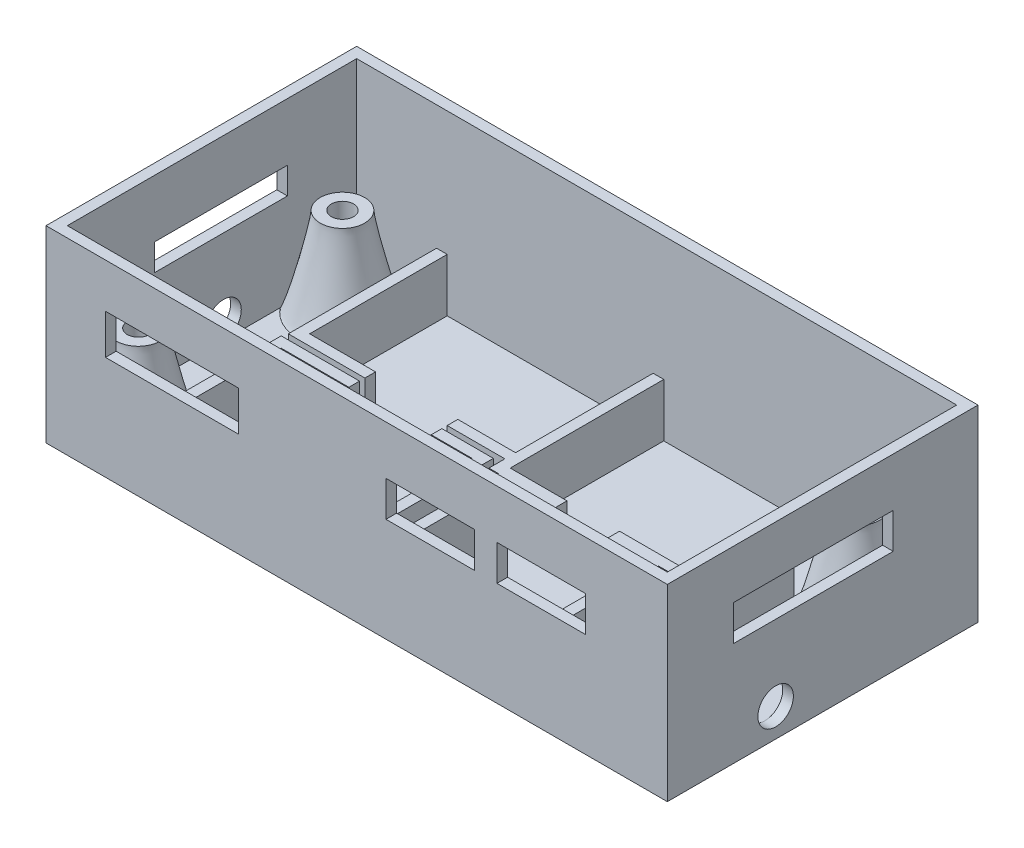
from build123d import *

# Parameters (mm, degrees)
SKETCH1_W           = 70
SKETCH1_H           = 35
BOSS_EXTRUDE1_DEPTH = 1.2
SKETCH2_W           = 70
SKETCH2_H           = 35
SKETCH2_W_2         = 67.6
SKETCH2_H_2         = 32.6
BOSS_EXTRUDE2_DEPTH = 20
SKETCH3_R           = 2.5
BOSS_EXTRUDE3_DEPTH = 10
SKETCH4_R           = 1.25
CUT_EXTRUDE1_DEPTH  = 80.05972426
SKETCH5_W           = 15
SKETCH5_H           = 3
CUT_EXTRUDE2_DEPTH  = 2
SKETCH7_W           = 10
SKETCH7_H           = 4
CUT_EXTRUDE3_DEPTH  = 2
SKETCH8_W           = 15
SKETCH8_H           = 4.5
CUT_EXTRUDE4_DEPTH  = 2
SKETCH9_W           = 18
SKETCH9_H           = 4
CUT_EXTRUDE5_DEPTH  = 2
FILLET1_SIZE        = 2.5
FILLET1_SIZE_2      = 10
BOSS_EXTRUDE4_DEPTH = 6
SKETCH11_W          = 1.2
SKETCH11_H          = 2.446219204
BOSS_EXTRUDE5_DEPTH = 6
BOSS_EXTRUDE6_DEPTH = 6
BOSS_EXTRUDE7_DEPTH = 6
SKETCH14_W          = 9.2726773
SKETCH14_H          = 6.430225757
SKETCH14_W_2        = 5.919458203
SKETCH14_H_2        = 4.800445035
CUT_EXTRUDE6_DEPTH  = 5
SKETCH15_R          = 2
CUT_EXTRUDE7_DEPTH  = 2
SKETCH16_R          = 2
CUT_EXTRUDE8_DEPTH  = 2


with BuildPart() as part:
    # Sketch1 → Boss-Extrude1 (new body)
    with BuildSketch(Plane(origin=(0, 0, 0), x_dir=(1, 0, 0), z_dir=(0, 1, 0))):
        with Locations((35, -17.5)):
            Rectangle(SKETCH1_W, SKETCH1_H)
    extrude(amount=BOSS_EXTRUDE1_DEPTH)

    # Sketch2 → Boss-Extrude2 (add)
    with BuildSketch(Plane(origin=(0, 1.2, 0), x_dir=(1, 0, 0), z_dir=(0, 1, 0))):
        with Locations((35, -17.5)):
            Rectangle(SKETCH2_W, SKETCH2_H)
        with Locations((35, -17.5)):
            Rectangle(SKETCH2_W_2, SKETCH2_H_2, mode=Mode.SUBTRACT)
    extrude(amount=BOSS_EXTRUDE2_DEPTH)

    # Sketch3 → Boss-Extrude3 (add)
    with BuildSketch(Plane(origin=(0, 1.2, 0), x_dir=(1, 0, 0), z_dir=(0, 1, 0))):
        with Locations(Location((5.2, -29.8, 0), (0, 0, 270))):
            Circle(SKETCH3_R)
        with Locations(Location((63.2, -29.8, 0), (0, 0, 270))):
            Circle(SKETCH3_R)
        with Locations(Location((63.2, -6.8, 0), (0, 0, 270))):
            Circle(SKETCH3_R)
        with Locations(Location((5.2, -6.8, 0), (0, 0, 270))):
            Circle(SKETCH3_R)
    extrude(amount=BOSS_EXTRUDE3_DEPTH)

    # Sketch4 → Cut-Extrude1 (cut, through all)
    with BuildSketch(Plane(origin=(0, 11.2, 0), x_dir=(1, 0, 0), z_dir=(0, 1, 0))):
        with Locations(Location((5.2, -29.8, 0), (0, 0, 270))):
            Circle(SKETCH4_R)
        with Locations(Location((5.2, -6.8, 0), (0, 0, 270))):
            Circle(SKETCH4_R)
        with Locations(Location((63.2, -6.8, 0), (0, 0, 270))):
            Circle(SKETCH4_R)
        with Locations(Location((63.2, -29.8, 0), (0, 0, 270))):
            Circle(SKETCH4_R)
    extrude(amount=-CUT_EXTRUDE1_DEPTH, mode=Mode.SUBTRACT)

    # Sketch5 → Cut-Extrude2 (cut)
    with BuildSketch(Plane.ZY):
        with Locations((16.5, 13.2)):
            Rectangle(SKETCH5_W, SKETCH5_H)
    extrude(amount=-CUT_EXTRUDE2_DEPTH, mode=Mode.SUBTRACT)

    # Sketch7 → Cut-Extrude3 (cut)
    with BuildSketch(Plane(origin=(0, 0, 33.8), x_dir=(-1, 0, 0), z_dir=(0, 0, -1))):
        with Locations((-55.8, 13.7)):
            Rectangle(SKETCH7_W, SKETCH7_H)
        with Locations((-43.3, 13.7)):
            Rectangle(SKETCH7_W, SKETCH7_H)
    extrude(amount=-CUT_EXTRUDE3_DEPTH, mode=Mode.SUBTRACT)

    # Sketch8 → Cut-Extrude4 (cut)
    with BuildSketch(Plane(origin=(0, 0, 33.8), x_dir=(-1, 0, 0), z_dir=(0, 0, -1))):
        with Locations((-14.2, 13.95)):
            Rectangle(SKETCH8_W, SKETCH8_H)
    extrude(amount=-CUT_EXTRUDE4_DEPTH, mode=Mode.SUBTRACT)

    # Sketch9 → Cut-Extrude5 (cut)
    with BuildSketch(Plane.ZY.offset(-68.8)):
        with Locations((18.55, 13.7)):
            Rectangle(SKETCH9_W, SKETCH9_H)
    extrude(amount=-CUT_EXTRUDE5_DEPTH, mode=Mode.SUBTRACT)

    # Fillet1
    # a fillet whose section is not a circle: 10, 2.5 mm, written as the material it adds along each edge
    with BuildSketch(Plane(origin=(5.2, 1.2, 29.8), x_dir=(0, 0, 1), z_dir=(-1, 0, 0))) as fillet1_piece_1:
        with BuildLine():
            Bezier((2.5 + FILLET1_SIZE, 0), (2.5, 0), (2.5, FILLET1_SIZE_2), weights=[1, 0.111111111, 1])
            Line((2.5, FILLET1_SIZE_2), (2.5, 0))
            Line((2.5, 0), (2.5 + FILLET1_SIZE, 0))
        make_face()
    revolve(axis=Axis((5.2, 1.2, 29.8), (0, 1, 0)))
    with BuildSketch(Plane(origin=(63.2, 1.2, 29.8), x_dir=(0, 0, 1), z_dir=(-1, 0, 0))) as fillet1_piece_2:
        with BuildLine():
            Bezier((2.5 + FILLET1_SIZE, 0), (2.5, 0), (2.5, FILLET1_SIZE_2), weights=[1, 0.111111111, 1])
            Line((2.5, FILLET1_SIZE_2), (2.5, 0))
            Line((2.5, 0), (2.5 + FILLET1_SIZE, 0))
        make_face()
    revolve(axis=Axis((63.2, 1.2, 29.8), (0, 1, 0)))
    with BuildSketch(Plane(origin=(63.2, 1.2, 6.8), x_dir=(0, 0, 1), z_dir=(-1, 0, 0))) as fillet1_piece_3:
        with BuildLine():
            Bezier((2.5 + FILLET1_SIZE, 0), (2.5, 0), (2.5, FILLET1_SIZE_2), weights=[1, 0.111111111, 1])
            Line((2.5, FILLET1_SIZE_2), (2.5, 0))
            Line((2.5, 0), (2.5 + FILLET1_SIZE, 0))
        make_face()
    revolve(axis=Axis((63.2, 1.2, 6.8), (0, 1, 0)))
    with BuildSketch(Plane(origin=(5.2, 1.2, 6.8), x_dir=(0, 0, 1), z_dir=(-1, 0, 0))) as fillet1_piece_4:
        with BuildLine():
            Bezier((2.5 + FILLET1_SIZE, 0), (2.5, 0), (2.5, FILLET1_SIZE_2), weights=[1, 0.111111111, 1])
            Line((2.5, FILLET1_SIZE_2), (2.5, 0))
            Line((2.5, 0), (2.5 + FILLET1_SIZE, 0))
        make_face()
    revolve(axis=Axis((5.2, 1.2, 6.8), (0, 1, 0)))

    # Sketch10 → Boss-Extrude4 (add)
    with BuildSketch(Plane(origin=(0, 1.2, 0), x_dir=(1, 0, 0), z_dir=(0, 1, 0))):
        Polygon((11.4, -16.7), (11.4, -1.2), (10.2, -1.2), (10.2, -17.9), (35.8, -17.9), (35.8, -1.2), (34.6, -1.2), (34.6, -16.7), align=None)
    extrude(amount=BOSS_EXTRUDE4_DEPTH)

    # Sketch11 → Boss-Extrude5 (add)
    with BuildSketch(Plane(origin=(0, 1.2, 0), x_dir=(1, 0, 0), z_dir=(0, 1, 0))):
        with Locations((58.5, -2.423109602)):
            Rectangle(SKETCH11_W, SKETCH11_H)
        Polygon((35.8, -17.9), (35.8, -18.5), (57.9, -18.5), (57.9, -9.85), (59.1, -9.85), (59.1, -19.7), (35.8, -19.7), (34.6, -19.7), (34.6, -17.9), align=None)
    extrude(amount=BOSS_EXTRUDE5_DEPTH)

    # Sketch12 → Boss-Extrude6 (add)
    with BuildSketch(Plane(origin=(0, 1.2, 0), x_dir=(1, 0, 0), z_dir=(0, 1, 0))):
        Polygon((11.2, -33.8), (11.2, -19.7), (32.7, -19.7), (32.7, -33.8), (33.9, -33.8), (33.9, -18.5), (10, -18.5), (10, -33.8), align=None)
    extrude(amount=BOSS_EXTRUDE6_DEPTH)

    # Sketch13 → Boss-Extrude7 (add)
    with BuildSketch(Plane(origin=(0, 1.2, 0), x_dir=(1, 0, 0), z_dir=(0, 1, 0))):
        Polygon((36.9, -33.8), (36.9, -20), (52.5, -20), (52.5, -33.8), (53.7, -33.8), (53.7, -19.7), (35.7, -19.7), (35.7, -33.8), align=None)
    extrude(amount=BOSS_EXTRUDE7_DEPTH)

    # Sketch14 → Cut-Extrude6 (cut)
    with BuildSketch(Plane(origin=(0, 7.2, 0), x_dir=(1, 0, 0), z_dir=(0, 1, 0))):
        with Locations((23.462805907, -18.345143962)):
            Rectangle(SKETCH14_W, SKETCH14_H)
        with Locations((45.156080477, -19.160034323)):
            Rectangle(SKETCH14_W_2, SKETCH14_H_2)
    extrude(amount=-CUT_EXTRUDE6_DEPTH, mode=Mode.SUBTRACT)

    # Sketch15 → Cut-Extrude7 (cut)
    with BuildSketch(Plane(origin=(1.2, 0, 0), x_dir=(0, 0, -1), z_dir=(1, 0, 0))):
        with Locations((-16.2, 3.2)):
            Circle(SKETCH15_R)
    extrude(amount=-CUT_EXTRUDE7_DEPTH, mode=Mode.SUBTRACT)

    # Sketch16 → Cut-Extrude8 (cut)
    with BuildSketch(Plane.ZY.offset(-68.8)):
        with Locations((22.8, 3.2)):
            Circle(SKETCH16_R)
    extrude(amount=-CUT_EXTRUDE8_DEPTH, mode=Mode.SUBTRACT)


solid = part.part
